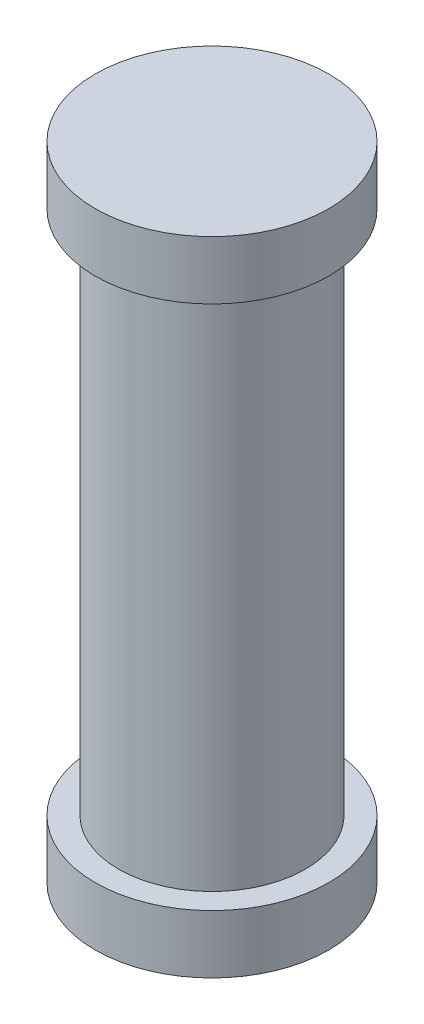
from build123d import *

# Parameters (mm, degrees)
SKETCH1_R           = 2
BOSS_EXTRUDE1_DEPTH = 1
SKETCH2_R           = 1.6
BOSS_EXTRUDE2_DEPTH = 9
SKETCH3_R           = 2
BOSS_EXTRUDE3_DEPTH = 1


with BuildPart() as part:
    # Sketch1 → Boss-Extrude1 (new body)
    with BuildSketch(Plane(origin=(0, 0, 0), x_dir=(1, 0, 0), z_dir=(0, 1, 0))):
        Circle(SKETCH1_R)
    extrude(amount=BOSS_EXTRUDE1_DEPTH)

    # Sketch2 → Boss-Extrude2 (add)
    with BuildSketch(Plane(origin=(0, 1, 0), x_dir=(1, 0, 0), z_dir=(0, 1, 0))):
        Circle(SKETCH2_R)
    extrude(amount=BOSS_EXTRUDE2_DEPTH)

    # Sketch3 → Boss-Extrude3 (add)
    with BuildSketch(Plane(origin=(0, 10, 0), x_dir=(1, 0, 0), z_dir=(0, 1, 0))):
        Circle(SKETCH3_R)
    extrude(amount=BOSS_EXTRUDE3_DEPTH)


solid = part.part
